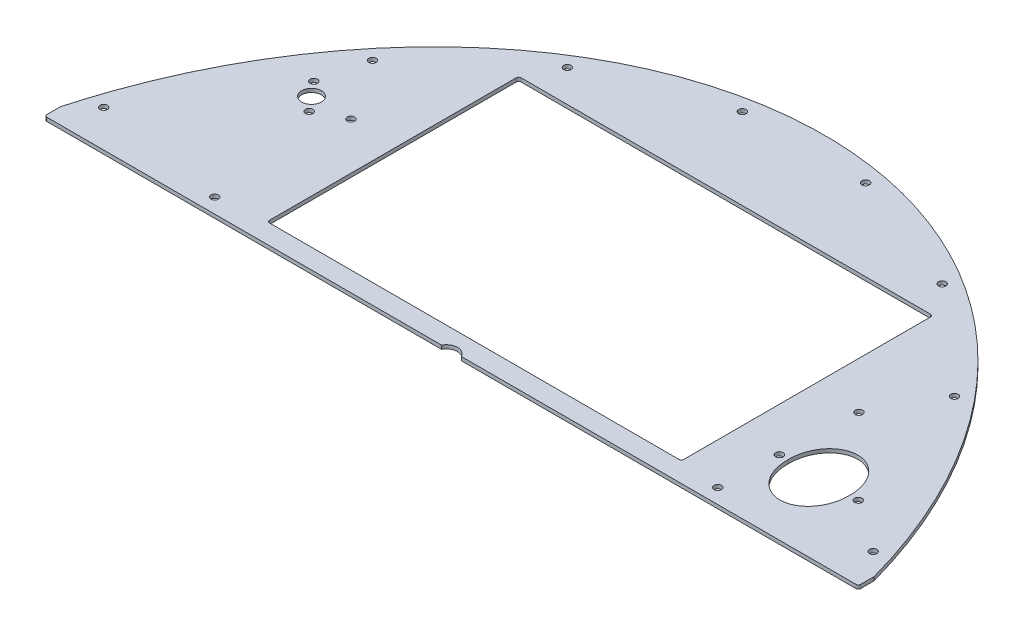
from build123d import *

# Parameters (mm, degrees)
BOSS_EXTRU_1_DEPTH      = 1.5
ESQUISSE4_R             = 4
ESQUISSE4_R_2           = 1.5
ESQUISSE4_W             = 168
ESQUISSE4_H             = 102
ENL_V_MAT_EXTRU_3_DEPTH = 3
ENL_V_MAT_EXTRU_4_DEPTH = 1.5
ESQUISSE11_R            = 1.5
ENL_V_MAT_EXTRU_5_DEPTH = 1.5
CONG_1_R                = 1
ESQUISSE12_R            = 1.5
ENL_V_MAT_EXTRU_6_DEPTH = 224.924001117


# Read off the part's stored shape, not the designer's step: Enlèv. mat.-Extru.4
with BuildPart() as part:
    # Esquisse1 → Boss.-Extru.1 (new body)
    with BuildSketch(Plane(origin=(0, 0, 0), x_dir=(1, 0, 0), z_dir=(0, 1, 0))):
        with BuildLine():
            Line((-165, 6.391802297), (-165, 0))
            Line((-165, 0), (165, 0))
            Line((165, 0), (165, 6.391802297))
            add(Edge.make_bspline(
                [(165, 6.391802297), (0, 608.094924715), (-165, 6.391802297)],
                knots=[1.893832827, 1.893832827, 1.893832827, 4.38935248, 4.38935248, 4.38935248], degree=2, weights=[1, 0.317447459, 1]))
        make_face()
    extrude(amount=BOSS_EXTRU_1_DEPTH)

    # Esquisse4 → Enlèv. mat.-Extru.3 (cut)
    with BuildSketch(Plane(origin=(0, 1.5, 0), x_dir=(1, 0, 0), z_dir=(0, 1, 0))):
        with Locations(Location((-117.74, 61, 0), (0, 0, 270))):
            Circle(ESQUISSE4_R)
        with Locations(Location((-112.919092927, 55.254666677, 0), (0, 0, 270))):
            Circle(ESQUISSE4_R_2)
        with Locations(Location((-122.560907073, 66.745333323, 0), (0, 0, 270))):
            Circle(ESQUISSE4_R_2)
        with Locations(Location((-101.74, 61, 0), (0, 0, 270))):
            Circle(ESQUISSE4_R_2)
        with Locations(Location((104.26, 61, 0), (0, 0, 270))):
            Circle(ESQUISSE4_R_2)
        with Locations((1.26, 59)):
            Rectangle(ESQUISSE4_W, ESQUISSE4_H)
    extrude(amount=-ENL_V_MAT_EXTRU_3_DEPTH, mode=Mode.SUBTRACT)

    # Enlèv. mat.-Extru.4 outline → Enlèv. mat.-Extru.4 (cut)
    with BuildSketch(Plane(origin=(0, 0, 0), x_dir=(1, 0, 0), z_dir=(0, 1, 0))):
        with BuildLine():
            add(Edge.make_bspline(
                [(131.492595534, 29.994209065), (131.937846155, 45.779047079), (119, 45.779047079), (106.062153845, 45.779047079), (106.507404466, 29.994209065)],
                knots=[1.536374944, 1.536374944, 1.536374944, 3.141592654, 3.141592654, 4.746810363, 4.746810363, 4.746810363], degree=2, weights=[1, 0.694832863, 1, 0.694832863, 1]))
            add(Edge.make_bspline(
                [(106.507404466, 29.994209065), (106.062153845, 14.209371052), (119, 14.209371052), (131.937846155, 14.209371052), (131.492595534, 29.994209065)],
                knots=[4.677967597, 4.677967597, 4.677967597, 6.283185307, 6.283185307, 7.888403017, 7.888403017, 7.888403017], degree=2, weights=[1, 0.694832863, 1, 0.694832863, 1]))
        make_face()
    extrude(amount=ENL_V_MAT_EXTRU_4_DEPTH, mode=Mode.SUBTRACT)

    # Esquisse11 → Enlèv. mat.-Extru.5 (cut)
    with BuildSketch(Plane(origin=(0, 1.5, 0), x_dir=(1, 0, 0), z_dir=(0, 1, 0))):
        with Locations(Location((103, 29.994209065, 0), (0, 0, 270))):
            Circle(ESQUISSE11_R)
        with Locations(Location((135, 29.994209065, 0), (0, 0, 90))):
            Circle(ESQUISSE11_R)
    extrude(amount=-ENL_V_MAT_EXTRU_5_DEPTH, mode=Mode.SUBTRACT)

    # Congé1
    cong_1_edges = [part.edges().sort_by_distance(p)[0] for p in [
        (-82.74, 0.75, -110),
        (-82.74, 0.75, -8),
        (85.26, 0.75, -8),
        (85.26, 0.75, -110),
        (165, 0.75, 0),
        (-165, 0.75, 0),
    ]]
    fillet(cong_1_edges, radius=CONG_1_R)

    # Esquisse12 → Enlèv. mat.-Extru.6 (cut, through all)
    with BuildSketch(Plane(origin=(0, 1.5, 0), x_dir=(1, 0, 0), z_dir=(0, 1, 0))):
        with Locations(Location((-156, 15, 0), (0, 0, 270))):
            Circle(ESQUISSE12_R)
        with Locations(Location((-76, 123, 0), (0, 0, 270))):
            Circle(ESQUISSE12_R)
        with Locations(Location((-25, 143, 0), (0, 0, 270))):
            Circle(ESQUISSE12_R)
        with Locations(Location((25, 143, 0), (0, 0, 270))):
            Circle(ESQUISSE12_R)
        with Locations(Location((76, 123, 0), (0, 0, 270))):
            Circle(ESQUISSE12_R)
        with Locations(Location((156, 15, 0), (0, 0, 270))):
            Circle(ESQUISSE12_R)
        with Locations(Location((-102, 6, 0), (0, 0, 270))):
            Circle(ESQUISSE12_R)
        with Locations(Location((102, 6, 0), (0, 0, 270))):
            Circle(ESQUISSE12_R)
        with Locations(Location((-118, 86, 0), (0, 0, 270))):
            Circle(ESQUISSE12_R)
        with Locations(Location((118, 86, 0), (0, 0, 270))):
            Circle(ESQUISSE12_R)
        with BuildLine():
            Line((-4, 0), (4, 0))
            ThreePointArc((4, 0), (0, 2.438447187), (-4, 0))
        make_face()
    extrude(amount=-ENL_V_MAT_EXTRU_6_DEPTH, mode=Mode.SUBTRACT)


solid = part.part
